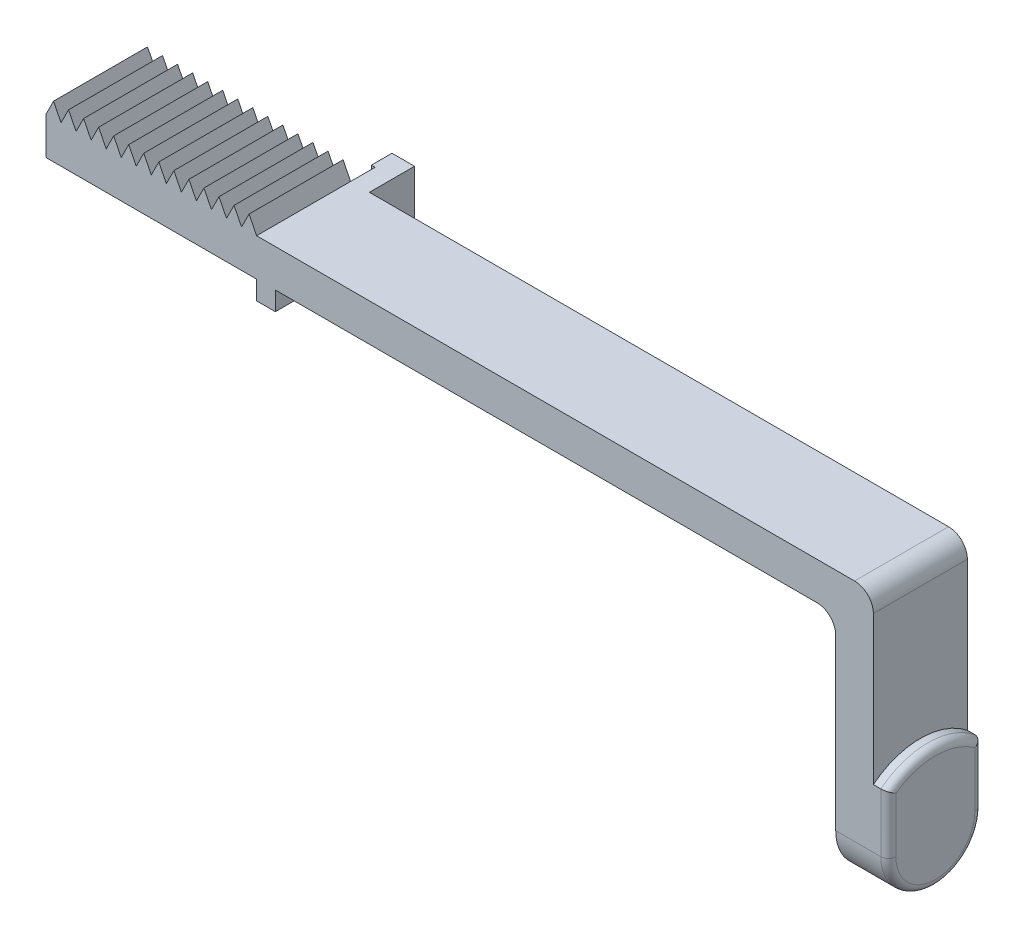
from build123d import *
from build123d.topology import SkipClean

# Parameters (mm, degrees)
BOSS_EXTRU_1_DEPTH      = 25
BOSS_EXTRU_2_DEPTH      = 12.5
ESQUISSE3_R             = 20
ESQUISSE3_R_2           = 15
BOSS_EXTRU_3_DEPTH      = 10
ENL_V_MAT_EXTRU_1_DEPTH = 227.418066155
ESQUISSE5_W             = 10
ESQUISSE5_H             = 5
ENL_V_MAT_EXTRU_2_DEPTH = 60
ESQUISSE6_R             = 20
BOSS_EXTRU_4_DEPTH      = 4
ESQUISSE8_R             = 2
ENL_V_MAT_EXTRU_4_DEPTH = 6
ESQUISSE10_W            = 5
ESQUISSE10_H            = 10
BOSS_EXTRU_5_DEPTH      = 10
BOSS_EXTRU_6_DEPTH      = 12
BOSS_EXTRU_8_START      = 10
ESQUISSE12_R            = 15
ESQUISSE12_R_2          = 11
BOSS_EXTRU_8_DEPTH      = 10
ENL_V_MAT_EXTRU_5_DEPTH = 20
CONG_1_R                = 2
BOSS_EXTRU_9_START      = 3
ESQUISSE14_R            = 11
BOSS_EXTRU_9_DEPTH      = 3
CONG_2_R                = 5
ESQUISSE16_W            = 5.5
ESQUISSE16_H            = 15
BOSS_EXTRU_10_DEPTH     = 1
ESQUISSE18_W            = 10.448813292
ESQUISSE18_H            = 10
ENL_V_MAT_EXTRU_8_DEPTH = 6
ESQUISSE19_W            = 5
ESQUISSE19_H            = 14.911099914
BOSS_EXTRU_11_DEPTH     = 25


with BuildPart() as part:
    # Esquisse1 → Boss.-Extru.1 (new body)
    with BuildSketch(Plane.XY):
        Polygon((5.298866479, 1.840607211), (-214.701133521, 1.840607211), (-214.701133521, -8.159392789), (-4.701133521, -8.159392789), (-4.701133521, -78.159392789), (5.298866479, -78.159392789), align=None)
    extrude(amount=BOSS_EXTRU_1_DEPTH)

    # Esquisse2 → Boss.-Extru.2 (add, symmetric)
    with BuildSketch(Plane.XY.offset(12.5)):
        Polygon((-160.701133521, 5.840607211), (-162.701133521, 1.840607211), (-158.701133521, 1.840607211), align=None)
        Polygon((-164.701133521, 5.840607211), (-166.701133521, 1.840607211), (-162.701133521, 1.840607211), align=None)
        Polygon((-168.701133521, 5.840607211), (-170.701133521, 1.840607211), (-166.701133521, 1.840607211), align=None)
        Polygon((-172.701133521, 5.840607211), (-174.701133521, 1.840607211), (-170.701133521, 1.840607211), align=None)
        Polygon((-176.701133521, 5.840607211), (-178.701133521, 1.840607211), (-174.701133521, 1.840607211), align=None)
        Polygon((-180.701133521, 5.840607211), (-182.701133521, 1.840607211), (-178.701133521, 1.840607211), align=None)
        Polygon((-184.701133521, 5.840607211), (-186.701133521, 1.840607211), (-182.701133521, 1.840607211), align=None)
        Polygon((-188.701133521, 5.840607211), (-190.701133521, 1.840607211), (-186.701133521, 1.840607211), align=None)
        Polygon((-192.701133521, 5.840607211), (-194.701133521, 1.840607211), (-190.701133521, 1.840607211), align=None)
        Polygon((-196.701133521, 5.840607211), (-198.701133521, 1.840607211), (-194.701133521, 1.840607211), align=None)
        Polygon((-200.701133521, 5.840607211), (-202.701133521, 1.840607211), (-198.701133521, 1.840607211), align=None)
        Polygon((-204.701133521, 5.840607211), (-206.701133521, 1.840607211), (-202.701133521, 1.840607211), align=None)
        Polygon((-208.701133521, 5.840607211), (-210.701133521, 1.840607211), (-206.701133521, 1.840607211), align=None)
        Polygon((-212.701133521, 5.840607211), (-214.701133521, 1.840607211), (-210.701133521, 1.840607211), align=None)
    extrude(amount=BOSS_EXTRU_2_DEPTH, both=True)

    # Esquisse3 → Boss.-Extru.3 (add)
    with BuildSketch(Plane.ZY.offset(4.701133521)):
        with Locations((12.5, -58.159392789)):
            Circle(ESQUISSE3_R)
        with Locations((12.5, -58.159392789)):
            Circle(ESQUISSE3_R_2, mode=Mode.SUBTRACT)
    extrude(amount=-BOSS_EXTRU_3_DEPTH)

    # Esquisse4 → Enlèv. mat.-Extru.1 (cut, through all)
    with BuildSketch(Plane.ZY.offset(4.701133521)):
        with BuildLine():
            ThreePointArc((12.5, -78.159392789), (5.876175573, -77.03066593), (0, -73.771887785))
            Line((0, -73.771887785), (0, -78.159392789))
            Line((0, -78.159392789), (12.5, -78.159392789))
        make_face()
        with BuildLine():
            Line((25, -78.159392789), (25, -73.771887785))
            ThreePointArc((25, -73.771887785), (19.123824427, -77.03066593), (12.5, -78.159392789))
            Line((12.5, -78.159392789), (25, -78.159392789))
        make_face()
        with BuildLine():
            Line((25, -66.450954765), (25, -49.867830813))
            ThreePointArc((25, -49.867830813), (12.5, -43.159392789), (0, -49.867830813))
            Line((0, -49.867830813), (0, -66.450954765))
            ThreePointArc((0, -66.450954765), (12.5, -73.159392789), (25, -66.450954765))
        make_face()
    extrude(amount=-ENL_V_MAT_EXTRU_1_DEPTH, mode=Mode.SUBTRACT)

    # Esquisse5 → Enlèv. mat.-Extru.2 (cut)
    with BuildSketch(Plane.ZY.offset(214.701133521)):
        with Locations((12.5, -5.659392789)):
            Rectangle(ESQUISSE5_W, ESQUISSE5_H)
    extrude(amount=-ENL_V_MAT_EXTRU_2_DEPTH, mode=Mode.SUBTRACT)

    # Esquisse6 → Boss.-Extru.4 (add)
    with SkipClean():  # the faces are left unmerged after this step: merging them gives an invalid solid
        with BuildSketch(Plane(origin=(5.298866479, 0, 0), x_dir=(0, 0, -1), z_dir=(1, 0, 0))):
            with Locations((-12.5, -58.159392789)):
                Circle(ESQUISSE6_R)
        extrude(amount=BOSS_EXTRU_4_DEPTH)
    add(part.part.scale(1), mode=Mode.REPLACE)  # the faces are merged on a copy

    # Esquisse8 → Enlèv. mat.-Extru.4 (cut)
    with BuildSketch(Plane.ZY.offset(214.701133521)):
        with Locations((12.5, -0.659392789)):
            Circle(ESQUISSE8_R)
    extrude(amount=-ENL_V_MAT_EXTRU_4_DEPTH, mode=Mode.SUBTRACT)

    # Esquisse10 → Boss.-Extru.5 (add)
    with BuildSketch(Plane.XY.offset(25)):
        with Locations((-156.201133521, -3.159392789)):
            Rectangle(ESQUISSE10_W, ESQUISSE10_H)
    extrude(amount=BOSS_EXTRU_5_DEPTH)

    # Esquisse11 → Boss.-Extru.6 (add)
    with SkipClean():  # the faces are left unmerged after this step: merging them gives an invalid solid
        with BuildSketch(Plane(origin=(0, 0, 0), x_dir=(-1, 0, 0), z_dir=(0, 0, -1))):
            Polygon((153.701133521, -8.159392789), (153.701133521, -13.159392789), (158.701133521, -13.159392789), (158.701133521, -8.159392789), (158.701133521, 1.840607211), (153.701133521, 1.840607211), align=None)
        extrude(amount=BOSS_EXTRU_6_DEPTH)

    # Esquisse12 → Boss.-Extru.8 (add)
    with SkipClean():  # the faces are left unmerged after this step: merging them gives an invalid solid
        with BuildSketch(Plane.ZY.offset(-5.298866479).offset(BOSS_EXTRU_8_START)):
            with Locations((12.5, -58.159392789)):
                Circle(ESQUISSE12_R)
            with Locations((12.5, -58.159392789)):
                Circle(ESQUISSE12_R_2, mode=Mode.SUBTRACT)
        extrude(amount=-BOSS_EXTRU_8_DEPTH)

    # Esquisse13 → Enlèv. mat.-Extru.5 (cut)
    with BuildSketch(Plane.ZY.offset(4.701133521)):
        with BuildLine():
            Line((0, -58.159392789), (0, -42.546897793))
            ThreePointArc((0, -42.546897793), (3.839745962, -76.187149167), (32.5, -58.159392789))
            ThreePointArc((32.5, -58.159392789), (30.527756377, -49.499138752), (25, -42.546897793))
            Line((25, -42.546897793), (25, -58.159392789))
            ThreePointArc((25, -58.159392789), (12.5, -70.659392789), (0, -58.159392789))
        make_face()
    extrude(amount=-ENL_V_MAT_EXTRU_5_DEPTH, mode=Mode.SUBTRACT)

    # Congé1
    cong_1_edges = [part.edges().sort_by_distance(p)[0] for p in [
        (9.298866479, -50.353145291, 0),
        (9.298866479, -70.659392789, 12.5),
        (9.298866479, -50.353145291, 25),
        (9.298866479, -38.159392789, 12.5),
    ]]
    fillet(cong_1_edges, radius=CONG_1_R)

    # Esquisse14 → Boss.-Extru.9 (add)
    with BuildSketch(Plane.ZY.offset(-5.298866479).offset(BOSS_EXTRU_9_START)):
        with Locations((12.5, -58.159392789)):
            Circle(ESQUISSE14_R)
    extrude(amount=-BOSS_EXTRU_9_DEPTH)

    # Congé2
    cong_2_edges = [part.edges().sort_by_distance(p)[0] for p in [
        (-4.701133521, -8.159392789, 12.5),
        (5.298866479, 1.840607211, 12.5),
    ]]
    fillet(cong_2_edges, radius=CONG_2_R)

    # Esquisse16 → Boss.-Extru.10 (add)
    with BuildSketch(Plane.ZY.offset(158.701133521)):
        with Locations((-9.25, -5.659392789)):
            Rectangle(ESQUISSE16_W, ESQUISSE16_H)
    extrude(amount=BOSS_EXTRU_10_DEPTH)

    # Esquisse18 → Enlèv. mat.-Extru.8 (cut)
    with BuildSketch(Plane.ZY.offset(158.701133521)):
        with Locations((30.224406646, -3.159392789)):
            Rectangle(ESQUISSE18_W, ESQUISSE18_H)
    extrude(amount=-ENL_V_MAT_EXTRU_8_DEPTH, mode=Mode.SUBTRACT)

    # Esquisse19 → Boss.-Extru.11 (add)
    with BuildSketch(Plane.XY):
        with Locations((-156.201133521, -5.703842832)):
            Rectangle(ESQUISSE19_W, ESQUISSE19_H)
    extrude(amount=BOSS_EXTRU_11_DEPTH)


solid = part.part
